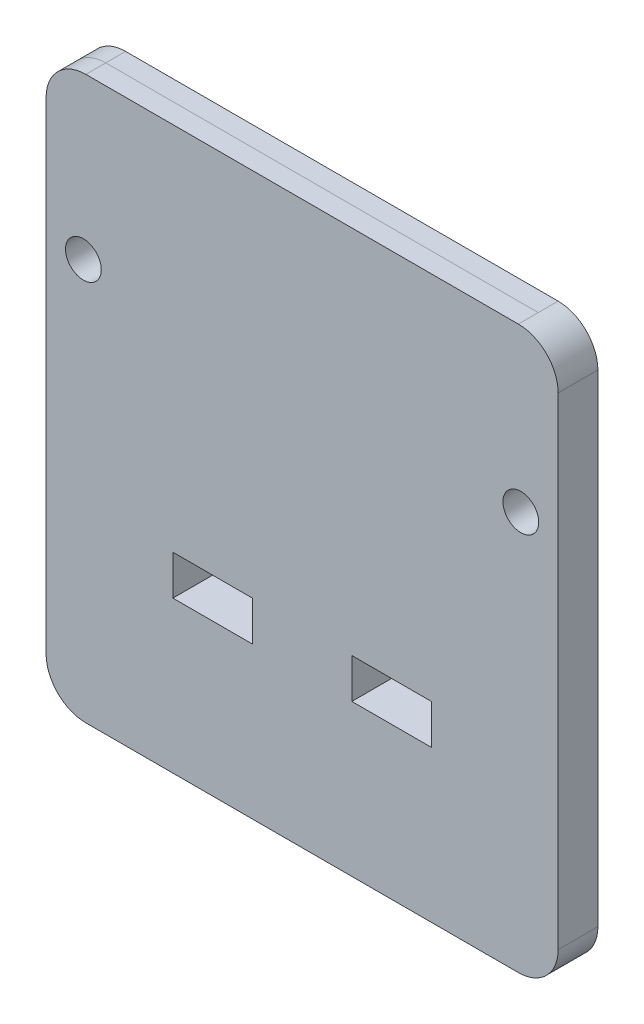
from build123d import *

# Parameters (mm, degrees)
SKETCH1_R                      = 11.422
BOSS_EXTRUDE1_DEPTH            = 25.4
SKETCH2_W                      = 50.8
SKETCH2_H                      = 25.4
FOAM_INSERT_CUT_THROUGHS_DEPTH = 25.4


with BuildPart() as part:
    # Sketch1 → Boss-Extrude1 (new body)
    with BuildSketch(Plane.XY):
        with BuildLine():
            Line((-138.113003809, -179.355296356), (138.113003809, -179.355296356))
            ThreePointArc((138.113003809, -179.355296356), (156.073516051, -171.915808598), (163.513003809, -153.955296356))
            Line((163.513003809, -153.955296356), (163.513003809, 153.955296356))
            ThreePointArc((163.513003809, 153.955296356), (156.073516051, 171.915808598), (138.113003809, 179.355296356))
            Line((138.113003809, 179.355296356), (-138.113003809, 179.355296356))
            ThreePointArc((-138.113003809, 179.355296356), (-156.073516051, 171.915808598), (-163.513003809, 153.955296356))
            Line((-163.513003809, 153.955296356), (-163.513003809, -153.955296356))
            ThreePointArc((-163.513003809, -153.955296356), (-156.073516051, -171.915808598), (-138.113003809, -179.355296356))
        make_face()
        with Locations((-139.7, 76.2)):
            Circle(SKETCH1_R, mode=Mode.SUBTRACT)
        with Locations((139.7, 76.2)):
            Circle(SKETCH1_R, mode=Mode.SUBTRACT)
    extrude(amount=BOSS_EXTRUDE1_DEPTH)

    # Sketch2 → Foam Insert Cut-Throughs (cut)
    with BuildSketch(Plane(origin=(0, 0, 0), x_dir=(-1, 0, 0), z_dir=(0, 0, -1))):
        with Locations((-57.15, -69.85)):
            Rectangle(SKETCH2_W, SKETCH2_H)
        with Locations((57.15, -69.85)):
            Rectangle(SKETCH2_W, SKETCH2_H)
    extrude(amount=-FOAM_INSERT_CUT_THROUGHS_DEPTH, mode=Mode.SUBTRACT)


solid = part.part
